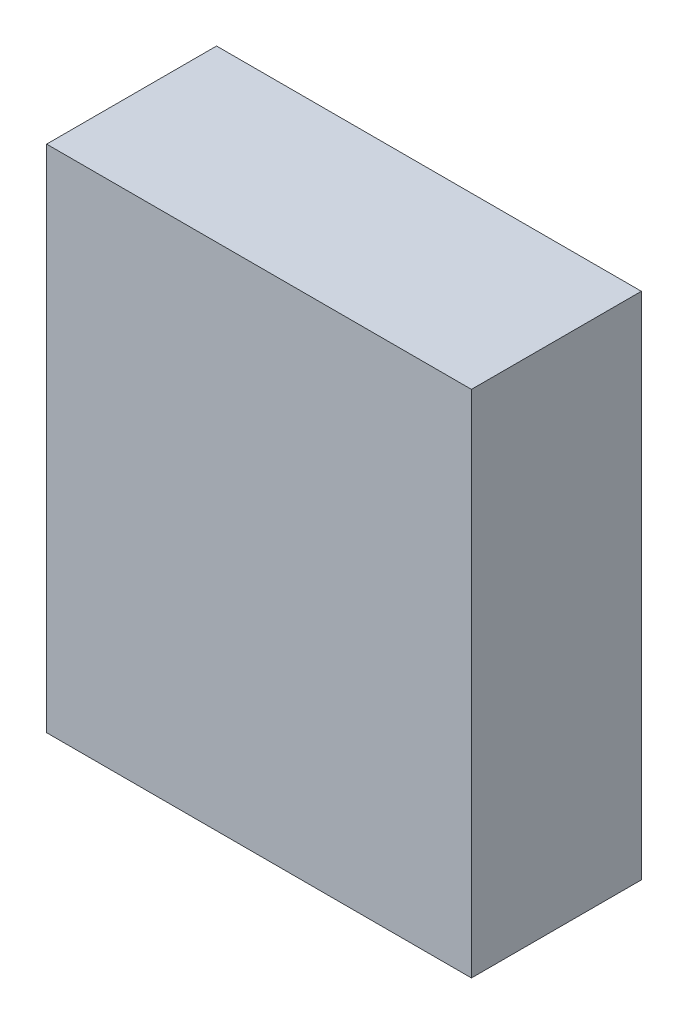
from build123d import *

# Parameters (mm, degrees)
SKETCH1_W           = 250
SKETCH1_H           = 300
BOSS_EXTRUDE1_DEPTH = 100
SKETCH2_W           = 15
SKETCH2_H           = 15
BOSS_EXTRUDE2_DEPTH = 7.5
FILLET1_R           = 7.5


with BuildPart() as part:
    # Sketch1 → Boss-Extrude1 (new body)
    with BuildSketch(Plane.XY):
        Rectangle(SKETCH1_W, SKETCH1_H)
    extrude(amount=BOSS_EXTRUDE1_DEPTH)

    # Sketch2 → Boss-Extrude2 (add)
    with BuildSketch(Plane(origin=(0, 0, 0), x_dir=(-1, 0, 0), z_dir=(0, 0, -1))):
        with Locations((0, 100)):
            Rectangle(SKETCH2_W, SKETCH2_H)
        with Locations((0, -100)):
            Rectangle(SKETCH2_W, SKETCH2_H)
    extrude(amount=BOSS_EXTRUDE2_DEPTH)

    # Fillet1
    fillet1_edges = [part.edges().sort_by_distance(p)[0] for p in [
        (0, 107.5, -7.5),
        (0, 92.5, -7.5),
        (0, -107.5, -7.5),
        (0, -92.5, -7.5),
    ]]
    fillet(fillet1_edges, radius=FILLET1_R - 0.0001)  # a hair under: the kernel refuses the full size


solid = part.part
